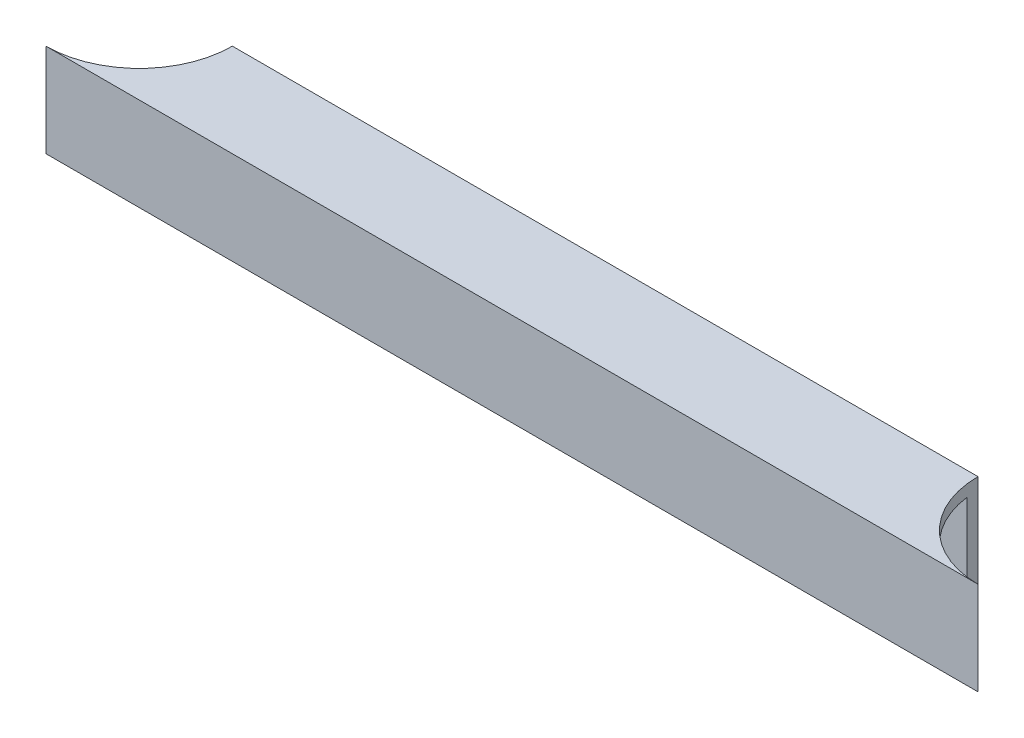
from build123d import *

# Parameters (mm, degrees)
BOSS_EXTRUDE1_DEPTH     = 25.4
CUT_EXTRUDE1_DEPTH      = 163.851117067
CUT_EXTRUDE1_DEPTH_BACK = 163.851117067
SKETCH2_W               = 19.05
SKETCH2_H               = 19.05


with BuildPart() as part:
    # Sketch1 → Boss-Extrude1 (new body)
    with BuildSketch(Plane(origin=(0, 0, 0), x_dir=(1, 0, 0), z_dir=(0, 1, 0))):
        with BuildLine():
            ThreePointArc((-101.6, -73.323484187), (-109.039487758, -91.283996429), (-127, -98.723484187))
            Line((-127, -98.723484187), (127, -98.723484187))
            ThreePointArc((127, -98.723484187), (109.039487758, -91.283996429), (101.6, -73.323484187))
            Line((101.6, -73.323484187), (-101.6, -73.323484187))
        make_face()
    extrude(amount=BOSS_EXTRUDE1_DEPTH)

    # Sketch2 → Cut-Extrude1 (cut, two sides: drawn at the far end of the back side and taken through both)
    with BuildSketch(Plane(origin=(0, 0, 0), x_dir=(0, 0, -1), z_dir=(1, 0, 0)).offset(-CUT_EXTRUDE1_DEPTH_BACK)):
        with Locations((-86.023484187, 12.7)):
            Rectangle(SKETCH2_W, SKETCH2_H)
    extrude(amount=CUT_EXTRUDE1_DEPTH + CUT_EXTRUDE1_DEPTH_BACK, mode=Mode.SUBTRACT)


solid = part.part
